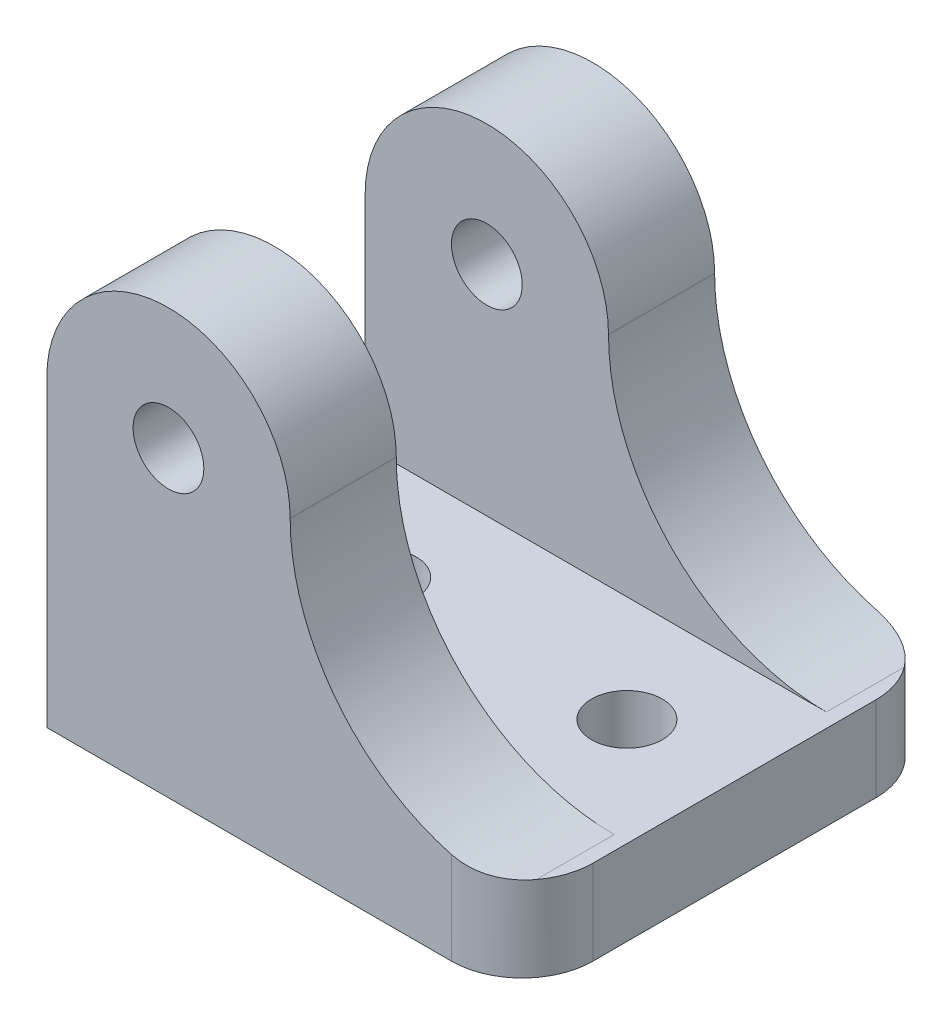
from build123d import *

# Parameters (mm, degrees)
SKETCH1_W           = 42.672
SKETCH1_H           = 38.1
BOSS_EXTRUDE1_DEPTH = 7.62
SKETCH3_R           = 3.175
CUT_EXTRUDE1_DEPTH  = 7.62
SKETCH4_R           = 10.922
SKETCH4_R_2         = 3.175
BOSS_EXTRUDE2_DEPTH = 9.525
FILLET1_START       = -9.525
FILLET1_DEPTH       = 9.525
FILLET2_R           = 6.35
FILLET3_R           = 6.35


with BuildPart() as part:
    # Sketch1 → Boss-Extrude1 (new body)
    with BuildSketch(Plane(origin=(0, 0, 0), x_dir=(1, 0, 0), z_dir=(0, 1, 0))):
        with Locations((21.336, 19.05)):
            Rectangle(SKETCH1_W, SKETCH1_H)
    extrude(amount=BOSS_EXTRUDE1_DEPTH)

    # Sketch3 → Cut-Extrude1 (cut)
    with BuildSketch(Plane(origin=(0, 7.62, 0), x_dir=(-1, 0, 0), z_dir=(0, 1, 0))):
        with Locations(Location((-10.922, -19.05, 0), (0, 0, 90))):
            Circle(SKETCH3_R)
        with Locations(Location((-33.02, -19.05, 0), (0, 0, 90))):
            Circle(SKETCH3_R)
    extrude(amount=-CUT_EXTRUDE1_DEPTH, mode=Mode.SUBTRACT)

    # Sketch4 → Boss-Extrude2 (add)
    # profile 1 of 2: a face of its own
    with BuildSketch(Plane.XY):
        with BuildLine():
            Line((0, 27.178), (0, 7.62))
            Line((0, 7.62), (21.844, 7.62))
            Line((21.844, 7.62), (21.844, 27.178))
            ThreePointArc((21.844, 27.178), (10.922, 16.256), (0, 27.178))
        make_face()
    # profile 2 of 2: a face of its own
    with BuildSketch(Plane.XY):
        with Locations((10.922, 27.178)):
            Circle(SKETCH4_R)
        with Locations((10.922, 27.178)):
            Circle(SKETCH4_R_2, mode=Mode.SUBTRACT)
    boss_extrude2 = extrude(amount=-BOSS_EXTRUDE2_DEPTH)

    # Fillet1: read off the stored shape, not the designer's step
    # Fillet1 outline → Fillet1 (add)
    with BuildSketch(Plane.XY.offset(FILLET1_START)):
        with BuildLine():
            Line((21.844, 7.62), (41.402, 7.62))
            add(Edge.make_bspline(
                [(41.402, 7.62), (21.844, 7.62), (21.844, 27.178)],
                knots=[0, 0, 0, 1, 1, 1], degree=2, weights=[1, 0.707106781, 1]))
            Line((21.844, 27.178), (21.844, 7.62))
        make_face()
    fillet1 = extrude(amount=FILLET1_DEPTH)

    # Fillet2
    fillet2_edges = [part.edges().sort_by_distance(p)[0] for p in [
        (42.672, 3.81, 0),
    ]]
    fillet(fillet2_edges, radius=FILLET2_R)

    # Mirror2: Boss-Extrude2, Fillet1 across plane
    add(boss_extrude2.mirror(Plane.XY.offset(-19.05)))
    add(fillet1.mirror(Plane.XY.offset(-19.05)))

    # Fillet3
    fillet3_edges = [part.edges().sort_by_distance(p)[0] for p in [
        (42.672, 3.81, -38.1),
    ]]
    fillet(fillet3_edges, radius=FILLET3_R)


solid = part.part
